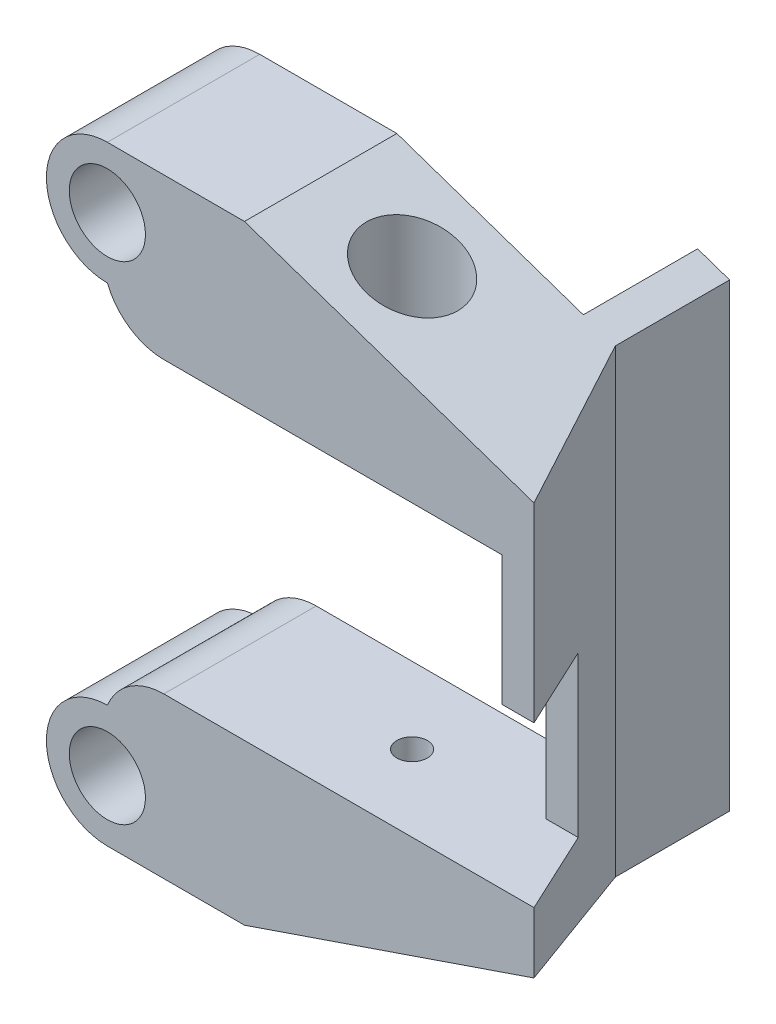
from build123d import *

# Parameters (mm, degrees)
CROQUIS1_R                = 2.5
SALIENTE_EXTRUIR1_DEPTH   = 10
CROQUIS2_R                = 1
CORTAR_EXTRUIR1_DEPTH     = 4
SALIENTE_EXTRUIR2_DEPTH   = 13.5
CROQUIS4_R                = 3
CORTAR_EXTRUIR2_DEPTH     = 1
SALIENTE_EXTRUIR3_START   = 6.5
CROQUIS6_R                = 3
SALIENTE_EXTRUIR3_DEPTH   = 6.5
CORTAR_EXTRUIR4_DEPTH     = 10
SALIENTE_EXTRUIR4_DEPTH   = 7.5
CORTAR_EXTRUIR5_START     = -5.437846722
CORTAR_EXTRUIR5_OUTLINE_W = 7
CORTAR_EXTRUIR5_OUTLINE_H = 10.5
CORTAR_EXTRUIR5_DEPTH     = 5.437846722
REDONDEO1_R               = 4
CORTAR_EXTRUIR6_DEPTH     = 1


# Read off the part's stored shape, not the designer's step: Cortar-Extruir5
with BuildPart() as part:
    # Croquis1 → Saliente-Extruir1 (new body)
    with BuildSketch(Plane.XY):
        with BuildLine():
            Line((-103.231635218, 22.700651543), (-131.231635218, 22.700651543))
            Line((-131.231635218, 22.700651543), (-131.231635218, 20.200651543))
            ThreePointArc((-131.231635218, 20.200651543), (-135.231635218, 16.200651543), (-131.231635218, 12.200651543))
            Line((-131.231635218, 12.200651543), (-125.231635218, 12.200651543))
            Line((-125.231635218, 12.200651543), (-125.231635218, 18.700651543))
            Line((-125.231635218, 18.700651543), (-103.231635218, 18.700651543))
            Line((-103.231635218, 18.700651543), (-103.231635218, 22.700651543))
        make_face()
        with Locations((-131.231635218, 16.200651543)):
            Circle(CROQUIS1_R, mode=Mode.SUBTRACT)
    extrude(amount=SALIENTE_EXTRUIR1_DEPTH)

    # Croquis2 → Cortar-Extruir1 (cut)
    with BuildSketch(Plane.XZ.offset(-18.700651543)):
        with Locations(Location((-116.231635218, 5, 0), (0, 0, 270))):
            Circle(CROQUIS2_R)
        Polygon((-103.231635218, -0.465140896), (-103.231635218, 10), (-108.111610562, -0.465140896), align=None)
    extrude(amount=-CORTAR_EXTRUIR1_DEPTH, mode=Mode.SUBTRACT)

    # Croquis3 → Saliente-Extruir2 (add)
    with BuildSketch(Plane.XZ.offset(-18.700651543)):
        Polygon((-103.231635218, 10), (-105.331635218, 10), (-109.9947118, 0), (-107.8947118, 0), align=None)
    extrude(amount=-SALIENTE_EXTRUIR2_DEPTH)

    # Croquis4 → Cortar-Extruir2 (cut)
    with BuildSketch(Plane.XZ.offset(-18.700651543)):
        with Locations(Location((-116.231635218, 5, 0), (0, 0, 270))):
            Circle(CROQUIS4_R)
    extrude(amount=-CORTAR_EXTRUIR2_DEPTH, mode=Mode.SUBTRACT)

    # Croquis6 → Saliente-Extruir3 (add)
    with BuildSketch(Plane.XZ.offset(-18.700651543).offset(SALIENTE_EXTRUIR3_START)):
        Polygon((-125.231635218, 10), (-103.231635218, 10), (-107.8947118, 0), (-125.231635218, 0), align=None)
        with Locations(Location((-116.231635218, 5, 0), (0, 0, 270))):
            Circle(CROQUIS6_R, mode=Mode.SUBTRACT)
    extrude(amount=-SALIENTE_EXTRUIR3_DEPTH)

    # Croquis7 → Cortar-Extruir4 (cut)
    with BuildSketch(Plane.XY.offset(10)):
        Polygon((-103.231635218, 18.700651543), (-103.231635218, 12.200651543), (-122.231635218, 12.200651543), align=None)
    extrude(amount=-CORTAR_EXTRUIR4_DEPTH, mode=Mode.SUBTRACT)

    # Croquis8 → Saliente-Extruir4 (add)
    with BuildSketch(Plane(origin=(0, 0, 0), x_dir=(-1, 0, 0), z_dir=(0, 0, -1))):
        Polygon((107.8947118, 17.105388502), (107.8947118, 32.200651543), (109.9947118, 32.200651543), (109.9947118, 22.700651543), (109.9947118, 16.386967449), align=None)
    extrude(amount=SALIENTE_EXTRUIR4_DEPTH)

    # Simetría1: part across plane


with BuildPart() as part_1:
    add(part.part)
    add(part.part.mirror(Plane(origin=(0, 32.200651543, 0), x_dir=(0, 0, 1), z_dir=(0, -1, 0))))

    # Cortar-Extruir5 outline → Cortar-Extruir5 (cut)
    with BuildSketch(Plane.XY.offset(10).offset(CORTAR_EXTRUIR5_START)):
        with Locations((-105.5, 27.950651543)):
            Rectangle(CORTAR_EXTRUIR5_OUTLINE_W, CORTAR_EXTRUIR5_OUTLINE_H)
    extrude(amount=CORTAR_EXTRUIR5_DEPTH, mode=Mode.SUBTRACT)

    # Redondeo1
    # the kernel refuses this fillet: 4 mm, written as the material it takes off along each edge
    with BuildSketch(Plane(origin=(-131.231635218, 41.700651543, -9.270248109), x_dir=(1, 0, 0), z_dir=(0, 0, 1))) as redondeo1_piece_1:
        with BuildLine():
            CenterArc((3.708099244, 4), REDONDEO1_R, 202.024312837, 67.975687163)
            Line((0, 2.5), (-0.074161985, 2.47))
            ThreePointArc((-0.074161985, 2.47), (-0.08, 1.25), (-0.08, 0))
            Line((-0.08, 0), (0, -0.08))
            Line((0, -0.08), (3.708099244, -0.08))
            Line((3.708099244, -0.08), (3.708099244, 0))
        make_face()
    extrude(amount=28.540496218, mode=Mode.SUBTRACT)
    with BuildSketch(Plane(origin=(-131.231635218, 22.700651543, -9.270248109), x_dir=(0, -1, 0), z_dir=(0, 0, 1))) as redondeo1_piece_2:
        with BuildLine():
            CenterArc((4, 3.708099244), REDONDEO1_R, 180, 67.975687168)
            Line((0, 3.708099244), (-0.08, 3.708099244))
            Line((-0.08, 3.708099244), (-0.08, 0))
            Line((-0.08, 0), (0, -0.08))
            ThreePointArc((0, -0.08), (1.25, -0.08), (2.47, -0.074161985))
            Line((2.47, -0.074161985), (2.5, 0))
        make_face()
    extrude(amount=28.540496218, mode=Mode.SUBTRACT)

    # Croquis9 → Cortar-Extruir6 (cut)
    # profile 1 of 3: a face of its own
    with BuildSketch(Plane.XZ.offset(-12.200651543)):
        with BuildLine():
            Line((-129.764534257, 5.621019863), (-130.078636821, 5.621019863))
            add(Edge.make_bspline(
                [(-130.078636821, 5.621019863), (-130.075578174, 5.66433116), (-130.069600311, 5.748979396), (-130.049422764, 5.871680196), (-130.022859828, 5.98739938), (-129.98587356, 6.094839134), (-129.942162893, 6.195406853), (-129.888125553, 6.287451544), (-129.827268399, 6.37298998), (-129.75760807, 6.450082268), (-129.681165466, 6.518828875), (-129.598729942, 6.578839154), (-129.510721278, 6.629359369), (-129.41733994, 6.671270123), (-129.318287546, 6.703202276), (-129.214126933, 6.726542169), (-129.104418704, 6.739794377), (-129.029559888, 6.741791346), (-128.991196917, 6.742814735)],
                knots=[0, 0, 0, 0, 1.189755348, 2.325275364, 3.405357674, 4.440728977, 5.436073419, 6.406440482, 7.361305578, 8.309505056, 9.248656041, 10.17524323, 11.099501498, 12.025889295, 12.976164651, 13.947715552, 14.948263773, 16, 16, 16, 16], degree=3))
            add(Edge.make_bspline(
                [(-128.991196917, 6.742814735), (-128.958683945, 6.741936545), (-128.894605699, 6.740205762), (-128.800507938, 6.728638409), (-128.710827515, 6.706932155), (-128.624994209, 6.678771099), (-128.543888711, 6.640761507), (-128.46602416, 6.596157845), (-128.393282684, 6.54155329), (-128.324786169, 6.480292242), (-128.262851953, 6.412816662), (-128.208722786, 6.340783943), (-128.16140714, 6.265593277), (-128.124894905, 6.185052309), (-128.09470334, 6.101551984), (-128.074918239, 6.013667089), (-128.061636702, 5.92220724), (-128.060158616, 5.859684264), (-128.059406051, 5.827850793)],
                knots=[0, 0, 0, 0, 1.070123652, 2.10905505, 3.112767961, 4.102712029, 5.07666027, 6.055516303, 7.050824346, 8.063894789, 9.076439522, 10.059426849, 11.02639504, 11.993363231, 12.96399535, 13.943485777, 14.952929115, 16, 16, 16, 16], degree=3))
            add(Edge.make_bspline(
                [(-128.059406051, 5.827850793), (-128.060976256, 5.782620148), (-128.064134204, 5.691653647), (-128.091619263, 5.556089805), (-128.134677494, 5.42132727), (-128.185205611, 5.308614551), (-128.240485779, 5.213816008), (-128.296051186, 5.130782766), (-128.365798338, 5.036942836), (-128.449898445, 4.932466294), (-128.54726483, 4.81619712), (-128.658732683, 4.688768782), (-128.784505221, 4.550623471), (-128.873740331, 4.45562933), (-128.920383615, 4.405975793)],
                knots=[0, 0, 0, 0, 0.954226203, 1.919110796, 2.908529265, 3.937684395, 4.519156821, 5.224000087, 6.046133778, 6.987113067, 8.055518501, 9.248081135, 10.561569138, 12, 12, 12, 12], degree=3))
            Line((-128.920383615, 4.405975793), (-129.783464545, 3.467173709))
            Line((-129.783464545, 3.467173709), (-128.238893231, 3.467173709))
            Line((-128.238893231, 3.467173709), (-128.278857173, 3.153071145))
            Line((-128.278857173, 3.153071145), (-130.482482974, 3.153071145))
            Line((-130.482482974, 3.153071145), (-129.309506212, 4.42841169))
            add(Edge.make_bspline(
                [(-129.309506212, 4.42841169), (-129.282141122, 4.458306883), (-129.228748507, 4.516636037), (-129.151022196, 4.602261043), (-129.077052711, 4.683303411), (-129.00864396, 4.761580204), (-128.943363051, 4.834922923), (-128.882199416, 4.904424821), (-128.825551079, 4.970025867), (-128.773462435, 5.03218421), (-128.725292832, 5.090121192), (-128.680996425, 5.143825684), (-128.641659252, 5.194155042), (-128.605862737, 5.23982101), (-128.57499016, 5.282458819), (-128.547508261, 5.320386243), (-128.525217839, 5.355166356), (-128.488729446, 5.41228622), (-128.447043577, 5.4966068), (-128.404453265, 5.60860815), (-128.378848602, 5.720133186), (-128.375264641, 5.794310693), (-128.373508615, 5.83065528)],
                knots=[0, 0, 0, 0, 1.413351346, 2.757620165, 4.032814388, 5.239603994, 6.38276682, 7.456908748, 8.468208299, 9.405290065, 10.284970074, 11.095810671, 11.832795857, 12.512582711, 13.11898356, 13.668494667, 14.145465748, 14.559277877, 16.031828034, 17.414029346, 18.732957739, 20, 20, 20, 20], degree=3))
            add(Edge.make_bspline(
                [(-128.373508615, 5.83065528), (-128.374037162, 5.85124858), (-128.375074827, 5.89167821), (-128.383585409, 5.951205225), (-128.398373965, 6.00803687), (-128.41889505, 6.062534516), (-128.445063972, 6.114630024), (-128.476554463, 6.164776452), (-128.514775996, 6.211731386), (-128.558165329, 6.25565415), (-128.605552728, 6.295967931), (-128.655914067, 6.332390429), (-128.710528471, 6.361456514), (-128.767334816, 6.386412965), (-128.827603596, 6.405148708), (-128.890585904, 6.419504051), (-128.957130844, 6.426948692), (-129.002399082, 6.428115432), (-129.025551885, 6.428712171)],
                knots=[0, 0, 0, 0, 1.000465277, 1.9641554, 2.914502411, 3.848972691, 4.78860488, 5.743285214, 6.720598248, 7.724474249, 8.739530682, 9.741606237, 10.737743132, 11.739883045, 12.752776938, 13.799858766, 14.874720116, 16, 16, 16, 16], degree=3))
            add(Edge.make_bspline(
                [(-129.025551885, 6.428712171), (-129.051294708, 6.428032883), (-129.101570403, 6.426706235), (-129.17524293, 6.416477111), (-129.245594298, 6.400682383), (-129.312675736, 6.377480865), (-129.375738842, 6.346897387), (-129.436070962, 6.311195643), (-129.492394298, 6.267995253), (-129.544697906, 6.218342514), (-129.592658832, 6.16285904), (-129.63463385, 6.101553604), (-129.671562903, 6.035015275), (-129.702214426, 5.962853304), (-129.726731561, 5.885069656), (-129.745455013, 5.80204117), (-129.759145867, 5.713496332), (-129.762706626, 5.652385978), (-129.764534257, 5.621019863)],
                knots=[0, 0, 0, 0, 1.007553214, 1.967749939, 2.906652842, 3.826866328, 4.739542757, 5.646559907, 6.567091782, 7.512083296, 8.465849621, 9.432866967, 10.41581379, 11.440668855, 12.496904277, 13.604523269, 14.770473504, 16, 16, 16, 16], degree=3))
        make_face()
    # profile 2 of 3: a face of its own
    with BuildSketch(Plane.XZ.offset(-12.200651543)):
        with BuildLine():
            Line((-126.623508615, 6.653071145), (-125.232482974, 6.653071145))
            Line((-125.232482974, 6.653071145), (-125.277354769, 6.338968581))
            Line((-125.277354769, 6.338968581), (-126.395644032, 6.338968581))
            Line((-126.395644032, 6.338968581), (-126.66417368, 5.474485408))
            add(Edge.make_bspline(
                [(-126.66417368, 5.474485408), (-126.645943028, 5.476098301), (-126.611357274, 5.479158155), (-126.56211192, 5.483871633), (-126.51835792, 5.485859502), (-126.490997675, 5.486232442), (-126.478376404, 5.486404479)],
                knots=[0, 0, 0, 0, 1.179194268, 2.23707438, 3.186763071, 4, 4, 4, 4], degree=3))
            add(Edge.make_bspline(
                [(-126.478376404, 5.486404479), (-126.436862286, 5.484655187), (-126.353865694, 5.481157938), (-126.231407319, 5.452583831), (-126.112254055, 5.406131361), (-125.997060671, 5.342720934), (-125.889515938, 5.262007055), (-125.79146617, 5.16662252), (-125.706428382, 5.055307227), (-125.634024165, 4.930797), (-125.575560554, 4.796152746), (-125.532118312, 4.654024786), (-125.506474382, 4.505296721), (-125.503313459, 4.40397072), (-125.501713744, 4.352690536)],
                knots=[0, 0, 0, 0, 0.899783298, 1.798880741, 2.712146335, 3.667462909, 4.641893168, 5.620639862, 6.625573659, 7.670753207, 8.73789667, 9.802833956, 10.8880339, 12, 12, 12, 12], degree=3))
            add(Edge.make_bspline(
                [(-125.501713744, 4.352690536), (-125.502306859, 4.323695062), (-125.503490347, 4.265838173), (-125.511336229, 4.179902738), (-125.524122177, 4.095196064), (-125.541231047, 4.011899514), (-125.564922984, 3.930140217), (-125.592655995, 3.849717678), (-125.625951558, 3.770582285), (-125.664071609, 3.693514407), (-125.706886732, 3.619561339), (-125.75222901, 3.549372663), (-125.800860529, 3.483734141), (-125.852832874, 3.422570075), (-125.908133135, 3.365905382), (-125.966448586, 3.313559577), (-126.028492785, 3.266785047), (-126.092876585, 3.223745111), (-126.160273244, 3.186044941), (-126.229504832, 3.153003334), (-126.301006826, 3.125360987), (-126.374533986, 3.103418095), (-126.449931131, 3.084539719), (-126.527576274, 3.072181615), (-126.607256154, 3.065256198), (-126.660888612, 3.063975324), (-126.688011821, 3.063327556)],
                knots=[0, 0, 0, 0, 1.069153237, 2.133363272, 3.179058996, 4.226954022, 5.266274036, 6.315550131, 7.362275136, 8.42982956, 9.483766617, 10.51159017, 11.509535653, 12.493806154, 13.468866151, 14.427139673, 15.380284545, 16.331557598, 17.280759563, 18.225176858, 19.15820187, 20.104151322, 21.053079409, 22.022142036, 22.999750219, 24, 24, 24, 24], degree=3))
            add(Edge.make_bspline(
                [(-126.688011821, 3.063327556), (-126.716540704, 3.063879557), (-126.773023049, 3.064972426), (-126.856537802, 3.073273294), (-126.937212094, 3.088417925), (-127.015710066, 3.107695149), (-127.091330265, 3.13385864), (-127.164522054, 3.165385502), (-127.234923884, 3.202930934), (-127.30322462, 3.245565274), (-127.368555815, 3.294954124), (-127.431292004, 3.350598675), (-127.490870644, 3.412976924), (-127.546820035, 3.482610916), (-127.60179905, 3.557119603), (-127.652919541, 3.639121524), (-127.701370285, 3.727382935), (-127.730455026, 3.789518509), (-127.745303487, 3.821240216)],
                knots=[0, 0, 0, 0, 0.988269415, 1.95660558, 2.903067029, 3.829898417, 4.754180254, 5.671628646, 6.587933176, 7.515648187, 8.458049413, 9.421533432, 10.417927647, 11.442155288, 12.514193677, 13.623848283, 14.786917344, 16, 16, 16, 16], degree=3))
            Line((-127.745303487, 3.821240216), (-127.423488583, 3.960763453))
            add(Edge.make_bspline(
                [(-127.423488583, 3.960763453), (-127.413259668, 3.937257112), (-127.393142667, 3.891027667), (-127.358660373, 3.825384797), (-127.322168922, 3.763884505), (-127.282835779, 3.706938328), (-127.240901448, 3.654458817), (-127.196476342, 3.606307672), (-127.14938696, 3.562961751), (-127.084842566, 3.510826227), (-126.99828057, 3.458448641), (-126.889593444, 3.411059627), (-126.775688982, 3.382627604), (-126.698215747, 3.379168963), (-126.659265827, 3.37743012)],
                knots=[0, 0, 0, 0, 0.90275949, 1.775438862, 2.609846295, 3.420523979, 4.211225742, 4.974361715, 5.725863837, 6.463852149, 7.894145469, 9.273469166, 10.629227771, 12, 12, 12, 12], degree=3))
            add(Edge.make_bspline(
                [(-126.659265827, 3.37743012), (-126.632815874, 3.378290778), (-126.58034916, 3.379997999), (-126.502693409, 3.392098841), (-126.427174871, 3.41281532), (-126.3530853, 3.440955555), (-126.280772549, 3.477341167), (-126.211091061, 3.523000046), (-126.1429586, 3.575846379), (-126.076748445, 3.635508837), (-126.014967092, 3.702140663), (-125.961792822, 3.776103684), (-125.916447352, 3.855518669), (-125.87909328, 3.940230015), (-125.851450686, 4.031264646), (-125.83001487, 4.127015157), (-125.818314381, 4.22900444), (-125.816663979, 4.298676679), (-125.815816308, 4.33446137)],
                knots=[0, 0, 0, 0, 0.894042656, 1.773442886, 2.649322443, 3.537059077, 4.448663481, 5.380047919, 6.348784549, 7.361222111, 8.390141551, 9.414226573, 10.433393002, 11.477070126, 12.53659607, 13.644646659, 14.790255748, 16, 16, 16, 16], degree=3))
            add(Edge.make_bspline(
                [(-125.815816308, 4.33446137), (-125.816519353, 4.364636714), (-125.817901976, 4.4239802), (-125.827871597, 4.510732652), (-125.843788903, 4.593392862), (-125.866763056, 4.671480177), (-125.89748218, 4.744935101), (-125.933654881, 4.814424599), (-125.976813423, 4.879582086), (-126.026484637, 4.939430905), (-126.080913961, 4.99390393), (-126.139182364, 5.042287528), (-126.202001363, 5.081915323), (-126.267630205, 5.115701376), (-126.337529601, 5.140661842), (-126.41101894, 5.158940121), (-126.488058783, 5.17052237), (-126.540735406, 5.171703573), (-126.567418872, 5.172301914)],
                knots=[0, 0, 0, 0, 1.147206095, 2.25612032, 3.315727791, 4.344786485, 5.344851775, 6.338579953, 7.319511098, 8.310533734, 9.290780363, 10.244278852, 11.183466438, 12.109444453, 13.045558043, 13.998186533, 14.985976718, 16, 16, 16, 16], degree=3))
            add(Edge.make_bspline(
                [(-126.567418872, 5.172301914), (-126.611213247, 5.170699477), (-126.700975831, 5.167415062), (-126.837848685, 5.143491685), (-126.97980779, 5.106073829), (-127.073708429, 5.06971104), (-127.122006212, 5.051007844)],
                knots=[0, 0, 0, 0, 0.919956117, 1.88557634, 2.91244643, 4, 4, 4, 4], degree=3))
            Line((-127.122006212, 5.051007844), (-126.623508615, 6.653071145))
        make_face()
    # profile 3 of 3: a face of its own
    with BuildSketch(Plane.XZ.offset(-12.200651543)):
        with BuildLine():
            add(Edge.make_bspline(
                [(-124.029357974, 6.742814735), (-124.00595609, 6.742086998), (-123.95964778, 6.740646933), (-123.891658642, 6.730852685), (-123.82649508, 6.713962722), (-123.764572233, 6.689837156), (-123.705040838, 6.659444936), (-123.648410055, 6.622297605), (-123.59456947, 6.578381446), (-123.544750948, 6.527991808), (-123.498041769, 6.473059851), (-123.458521116, 6.412319093), (-123.423489538, 6.348165269), (-123.39556943, 6.279483187), (-123.374671918, 6.206504341), (-123.359355757, 6.129598861), (-123.349038547, 6.048515284), (-123.348262502, 5.992880741), (-123.34786759, 5.964569543)],
                knots=[0, 0, 0, 0, 0.970717871, 1.920883944, 2.842680434, 3.757311267, 4.672198984, 5.610669493, 6.561577208, 7.54876171, 8.546788736, 9.547073532, 10.549095219, 11.575307918, 12.615394826, 13.693467145, 14.826256018, 16, 16, 16, 16], degree=3))
            add(Edge.make_bspline(
                [(-123.34786759, 5.964569543), (-123.348376243, 5.931574461), (-123.349371865, 5.866990869), (-123.362016533, 5.772531875), (-123.380793887, 5.682475499), (-123.406498463, 5.596277744), (-123.440971614, 5.514774698), (-123.483522882, 5.438049997), (-123.532520745, 5.365336911), (-123.589282732, 5.298463839), (-123.651365026, 5.237805281), (-123.717284449, 5.184089115), (-123.787396256, 5.138814454), (-123.860951139, 5.101675719), (-123.938211168, 5.072444382), (-124.018936882, 5.052374666), (-124.103302873, 5.040136287), (-124.160659585, 5.038513994), (-124.189914865, 5.03768653)],
                knots=[0, 0, 0, 0, 1.130854088, 2.213500164, 3.262022406, 4.283858738, 5.293169922, 6.29044296, 7.288617459, 8.29537939, 9.292942272, 10.261820963, 11.206697579, 12.149430033, 13.082848615, 14.033453143, 14.996945993, 16, 16, 16, 16], degree=3))
            add(Edge.make_bspline(
                [(-124.189914865, 5.03768653), (-124.213791247, 5.038368207), (-124.260581362, 5.039704077), (-124.329343517, 5.050007383), (-124.395316997, 5.065687036), (-124.458343598, 5.089126144), (-124.517786467, 5.119461779), (-124.574731264, 5.155686307), (-124.628799255, 5.198403939), (-124.678780515, 5.248051715), (-124.724387203, 5.302706781), (-124.764588814, 5.361734184), (-124.79844048, 5.425204149), (-124.825515805, 5.492835015), (-124.847509542, 5.563811254), (-124.862895712, 5.63893283), (-124.872110571, 5.718008189), (-124.873036843, 5.772203166), (-124.873508615, 5.799805921)],
                knots=[0, 0, 0, 0, 0.998939331, 1.957603429, 2.904214697, 3.832710991, 4.764499105, 5.69253155, 6.653438724, 7.642559757, 8.635735374, 9.628718291, 10.626459594, 11.640042448, 12.673490826, 13.732455774, 14.845087277, 16, 16, 16, 16], degree=3))
            add(Edge.make_bspline(
                [(-124.873508615, 5.799805921), (-124.872613732, 5.83302177), (-124.870862887, 5.898008731), (-124.859662031, 5.993574801), (-124.840146948, 6.084665839), (-124.812430422, 6.171331392), (-124.778311825, 6.254126123), (-124.735100015, 6.332136288), (-124.684408205, 6.40610516), (-124.626532821, 6.475042833), (-124.563225167, 6.537492539), (-124.496629303, 6.592985703), (-124.425814695, 6.638452658), (-124.352796103, 6.67676259), (-124.276393877, 6.706516284), (-124.19688792, 6.727396929), (-124.114161037, 6.740515195), (-124.05791958, 6.742040252), (-124.029357974, 6.742814735)],
                knots=[0, 0, 0, 0, 1.130922342, 2.21265473, 3.270805013, 4.297553847, 5.306888354, 6.314716204, 7.327776304, 8.355757729, 9.374178632, 10.352259942, 11.301297143, 12.233743801, 13.155811409, 14.086116658, 15.028055401, 16, 16, 16, 16], degree=3))
        make_face()
        with BuildLine():
            add(Edge.make_bspline(
                [(-124.041277045, 6.473583966), (-124.065437173, 6.472716923), (-124.113559402, 6.470989944), (-124.184824542, 6.454520312), (-124.2545212, 6.428648356), (-124.321483153, 6.391898253), (-124.384623611, 6.346969267), (-124.440661172, 6.291774464), (-124.490205968, 6.228415636), (-124.530975697, 6.156091368), (-124.564069486, 6.077829892), (-124.587147294, 5.993906593), (-124.60142672, 5.905463433), (-124.603316297, 5.844732493), (-124.604277846, 5.813828357)],
                knots=[0, 0, 0, 0, 0.898823508, 1.790279833, 2.710439412, 3.660988812, 4.627551506, 5.588017192, 6.580694835, 7.614151002, 8.671642138, 9.738410943, 10.84914581, 12, 12, 12, 12], degree=3))
            add(Edge.make_bspline(
                [(-124.604277846, 5.813828357), (-124.602911126, 5.777248126), (-124.600287369, 5.707023355), (-124.577177406, 5.60714081), (-124.537158391, 5.519257323), (-124.483253304, 5.443461721), (-124.416306256, 5.383106), (-124.340488231, 5.338225557), (-124.25572304, 5.311263624), (-124.196418801, 5.308388375), (-124.166076724, 5.306917299)],
                knots=[0, 0, 0, 0, 1.167761783, 2.24180663, 3.250972385, 4.235329223, 5.192198183, 6.109164403, 7.032583837, 8, 8, 8, 8], degree=3))
            add(Edge.make_bspline(
                [(-124.166076724, 5.306917299), (-124.145940954, 5.307369211), (-124.106618138, 5.308251743), (-124.048967082, 5.317748153), (-123.994453304, 5.333130826), (-123.942653176, 5.354061025), (-123.894410532, 5.382107012), (-123.848932928, 5.415621303), (-123.806391199, 5.455422082), (-123.767650427, 5.500919394), (-123.732229586, 5.550170399), (-123.701071658, 5.602387337), (-123.674964871, 5.657309503), (-123.654378424, 5.714791993), (-123.637025457, 5.774140554), (-123.625316074, 5.836116623), (-123.618114934, 5.900594048), (-123.617440221, 5.944451366), (-123.617098359, 5.966672908)],
                knots=[0, 0, 0, 0, 1.007750251, 1.968018882, 2.916659645, 3.840494567, 4.758079246, 5.703899357, 6.664595947, 7.668873183, 8.692139613, 9.699889865, 10.710423493, 11.732484109, 12.755080818, 13.804198226, 14.88743536, 16, 16, 16, 16], degree=3))
            add(Edge.make_bspline(
                [(-123.617098359, 5.966672908), (-123.61839354, 6.003977096), (-123.620865503, 6.075175285), (-123.644524836, 6.175534778), (-123.682255418, 6.264360974), (-123.73684158, 6.338431176), (-123.80129501, 6.398605059), (-123.87434795, 6.442841461), (-123.955642403, 6.469018067), (-124.01234289, 6.472041244), (-124.041277045, 6.473583966)],
                knots=[0, 0, 0, 0, 1.207628711, 2.304861276, 3.322697533, 4.315405203, 5.264472711, 6.164993415, 7.063599473, 8, 8, 8, 8], degree=3))
        make_face(mode=Mode.SUBTRACT)
    extrude(amount=-CORTAR_EXTRUIR6_DEPTH, mode=Mode.SUBTRACT)


solid = part_1.part
